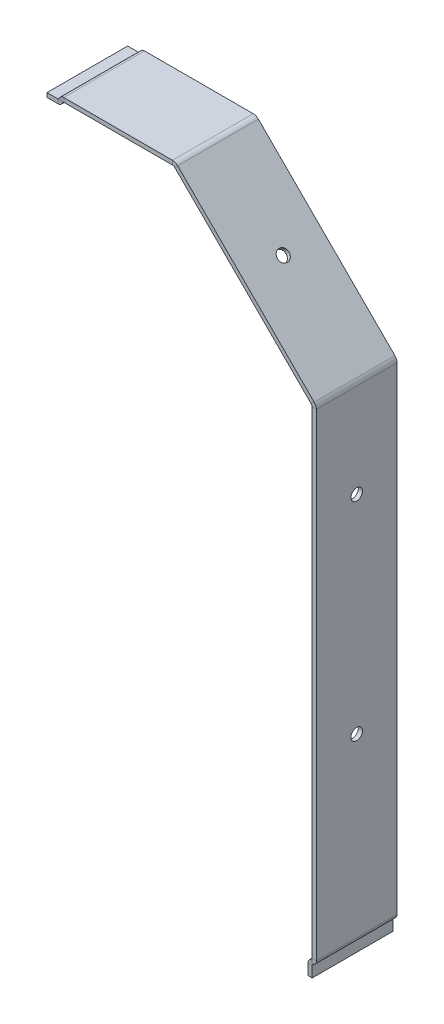
from build123d import *

# Parameters (mm, degrees)
BASE_FLANGE1_START                     = -44.45
BASE_FLANGE1_DEPTH                     = 44.45
SKETCH2_R                              = 3.175
CE_00_HOLES_0_250_SIDE_2_PLACES_DEPTH  = 7.62
SKETCH4_R                              = 3.175
CE_00_HOLES_0_250_ANGLED_1_PLACE_DEPTH = 7.62


# Read off the part's stored shape, not the designer's step: Base-Flange1
with BuildPart() as part:
    # Base-Flange1 outline → Base-Flange1 (new body)
    with BuildSketch(Plane.XY.offset(BASE_FLANGE1_START)):
        with BuildLine():
            ThreePointArc((0.146646968, 139.954), (-0.039293937, 139.768059095), (-0.293293937, 139.7))
            Line((-0.293293937, 139.7), (-6.35, 139.7))
            Line((-6.35, 139.7), (-6.35, 137.414))
            Line((-6.35, 137.414), (-0.293293937, 137.414))
            ThreePointArc((-0.293293937, 137.414), (1.103706063, 137.788325022), (2.126381041, 138.811))
            Line((2.126381041, 138.811), (2.492998462, 139.446))
            ThreePointArc((2.492998462, 139.446), (2.678939367, 139.631940905), (2.932939367, 139.7))
            Line((2.932939367, 139.7), (62.784570335, 139.7))
            ThreePointArc((62.784570335, 139.7), (63.44554116, 139.568524729), (64.005885168, 139.194114832))
            Line((64.005885168, 139.194114832), (139.194114832, 64.005885168))
            ThreePointArc((139.194114832, 64.005885168), (139.568524729, 63.44554116), (139.7, 62.784570335))
            Line((139.7, 62.784570335), (139.7, -200.267060633))
            ThreePointArc((139.7, -200.267060633), (139.631940905, -200.521060633), (139.446, -200.707001538))
            Line((139.446, -200.707001538), (138.811, -201.073618959))
            ThreePointArc((138.811, -201.073618959), (137.788325022, -202.096293937), (137.414, -203.493293937))
            Line((137.414, -203.493293937), (137.414, -209.55))
            Line((137.414, -209.55), (139.7, -209.55))
            Line((139.7, -209.55), (139.7, -203.493293937))
            ThreePointArc((139.7, -203.493293937), (139.768059095, -203.239293937), (139.954, -203.053353032))
            Line((139.954, -203.053353032), (140.589, -202.686735611))
            ThreePointArc((140.589, -202.686735611), (141.611674978, -201.664060633), (141.986, -200.267060633))
            Line((141.986, -200.267060633), (141.986, 62.784570335))
            ThreePointArc((141.986, 62.784570335), (141.68051334, 64.320355486), (140.810560934, 65.622331269))
            Line((140.810560934, 65.622331269), (65.622331269, 140.810560934))
            ThreePointArc((65.622331269, 140.810560934), (64.320355486, 141.68051334), (62.784570335, 141.986))
            Line((62.784570335, 141.986), (2.932939367, 141.986))
            ThreePointArc((2.932939367, 141.986), (1.535939367, 141.611674978), (0.513264389, 140.589))
            Line((0.513264389, 140.589), (0.146646968, 139.954))
        make_face()
    extrude(amount=BASE_FLANGE1_DEPTH)

    # Sketch2 → CE-00 Holes 0.250 Side 2 Places (cut)
    with BuildSketch(Plane(origin=(141.986, 0, 0), x_dir=(0, 0, -1), z_dir=(1, 0, 0))):
        with Locations(Location((22.225, 11.1252, 0), (0, 0, 90))):
            Circle(SKETCH2_R)
        with Locations(Location((22.225, -103.1748, 0), (0, 0, 90))):
            Circle(SKETCH2_R)
    extrude(amount=-CE_00_HOLES_0_250_SIDE_2_PLACES_DEPTH, mode=Mode.SUBTRACT)

    # Sketch4 → CE-00 Holes 0.250 Angled 1 Place (cut)
    with BuildSketch(Plane(origin=(103.216446102, 103.216446102, 0), x_dir=(0, 0, -1), z_dir=(0.7071067811865511, 0.7071067811865439, 0))):
        with Locations(Location((22.225, 2.366107061, 0), (0, 0, 90))):
            Circle(SKETCH4_R)
    extrude(amount=-CE_00_HOLES_0_250_ANGLED_1_PLACE_DEPTH, mode=Mode.SUBTRACT)


solid = part.part
